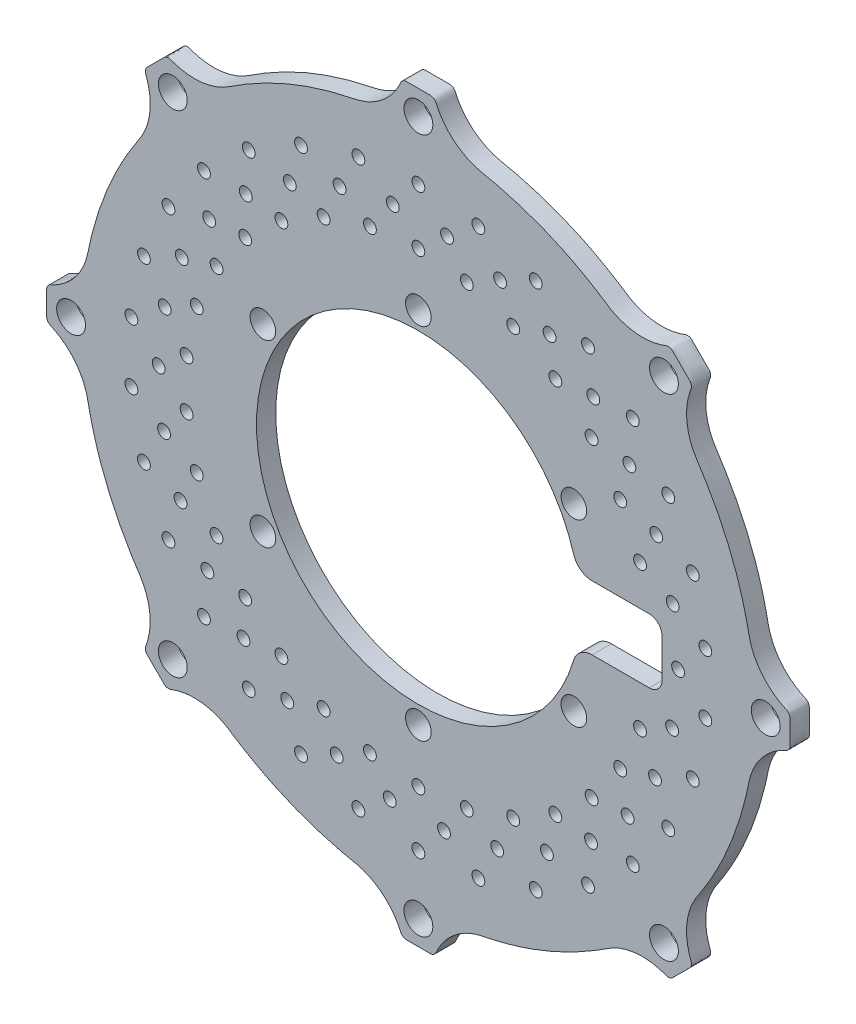
from build123d import *

# Parameters (mm, degrees)
SKETCH1_R                 = 1
BOSS_EXTRUDE1_DEPTH       = 3
F_4_0MM_DOWEL_HOLE1_D     = 4
F_4_0MM_DOWEL_HOLE1_DEPTH = 4
F_4_0MM_DOWEL_HOLE1_TIP   = 1.201721238
M4_CLEARANCE_HOLE1_D      = 4.5
M4_CLEARANCE_HOLE1_DEPTH  = 4
M4_CLEARANCE_HOLE1_TIP    = 1.351936393


with BuildPart() as part:
    # Sketch1 → Boss-Extrude1 (new body)
    with BuildSketch(Plane.XY):
        with BuildLine():
            add(Edge.make_bspline(
                [(-2.792588463, 57.296622314), (-2.798610234, 57.282848917), (-2.831786589, 57.2065726), (-2.866328079, 57.131672052), (-2.895249818, 57.070593275)],
                knots=[0.999327537, 0.999327537, 0.999327537, 0.999327537, 0.999448998, 1, 1, 1, 1], degree=3, weights=[1, 1, 1, 1, 1]))
            add(Edge.make_bspline(
                [(-2.895249818, 57.070593275), (-3.907352197, 54.933170755), (-5.586945631, 53.268270712), (-7.733178428, 52.274987752), (-8.218210626, 52.050513399), (-9.224266632, 51.679333443), (-10.81473369, 51.382377685), (-11.857368808, 51.146245707), (-12.376762361, 51.020248465), (-17.660128133, 49.738581586), (-22.682891966, 47.658084686), (-27.325071073, 44.828456262), (-27.781431281, 44.550283063), (-28.685656165, 43.979999224), (-30.020265638, 43.065348612), (-30.994118526, 42.616423452), (-31.495815419, 42.432181232), (-33.809504892, 41.582506281), (-36.274163076, 41.606308243), (-38.571011409, 42.500508575), (-38.571845248, 42.500833202), (-38.573512838, 42.50148268), (-38.57601405, 42.502457345), (-38.577681205, 42.503107942), (-38.578514782, 42.50343324), (-38.579346338, 42.50375775), (-38.581009449, 42.504406769), (-38.583504116, 42.505380297), (-38.585167228, 42.506029317), (-38.585998784, 42.506353826), (-38.590988118, 42.508300883), (-38.595977452, 42.510247941), (-38.600966787, 42.512194998), (-38.601798343, 42.512519508), (-38.603461454, 42.513168527), (-38.605956121, 42.514142055), (-38.607619233, 42.514791074), (-38.608450788, 42.515115584), (-38.60928525, 42.515441228), (-38.610954174, 42.516092515), (-38.613462374, 42.517057113), (-38.615135637, 42.517697174), (-38.615972697, 42.51801608), (-38.892469699, 42.623356827), (-39.187709119, 42.603838871), (-39.447932521, 42.463016124), (-39.476110803, 42.447767138), (-39.531001645, 42.414560688), (-39.611133429, 42.358611372), (-39.656444513, 42.313300288), (-39.679100055, 42.290644746), (-39.701755597, 42.267989204), (-39.747066681, 42.22267812), (-39.815033308, 42.154711493), (-39.860344392, 42.109400409), (-39.882999934, 42.086744867), (-40.617581578, 41.352163223), (-41.352163223, 40.617581578), (-42.086744867, 39.882999934), (-42.109400409, 39.860344392), (-42.154711493, 39.815033308), (-42.22267812, 39.747066681), (-42.267989204, 39.701755597), (-42.290644746, 39.679100055), (-42.313300288, 39.656444513), (-42.358611372, 39.611133429), (-42.414560688, 39.531001645), (-42.447767138, 39.476110803), (-42.463016124, 39.447932521), (-42.603838871, 39.187709119), (-42.623356827, 38.892469699), (-42.51801608, 38.615972697), (-42.517697174, 38.615135637), (-42.517057113, 38.613462374), (-42.516092515, 38.610954174), (-42.515441228, 38.60928525), (-42.515115584, 38.608450788), (-42.514791074, 38.607619233), (-42.514142055, 38.605956121), (-42.513168527, 38.603461454), (-42.512519508, 38.601798343), (-42.512194998, 38.600966787), (-42.510247941, 38.595977452), (-42.508300883, 38.590988118), (-42.506353826, 38.585998784), (-42.506029317, 38.585167228), (-42.505380297, 38.583504116), (-42.504406769, 38.581009449), (-42.50375775, 38.579346338), (-42.50343324, 38.578514782), (-42.503107942, 38.577681205), (-42.502457345, 38.57601405), (-42.50148268, 38.573512838), (-42.500833202, 38.571845248), (-42.500508575, 38.571011409), (-41.606308243, 36.274163076), (-41.582506281, 33.809504892), (-42.432181232, 31.495815419), (-42.616423452, 30.994118526), (-43.065348612, 30.020265638), (-43.979999224, 28.685656165), (-44.550283063, 27.781431281), (-44.828456262, 27.325071073), (-47.658084686, 22.682891966), (-49.738581586, 17.660128133), (-51.020248465, 12.376762361), (-51.146245707, 11.857368808), (-51.382377685, 10.81473369), (-51.679333443, 9.224266632), (-52.050513399, 8.218210626), (-52.274987752, 7.733178428), (-53.310202347, 5.496341992), (-55.069809391, 3.770396005), (-57.326221542, 2.778574093), (-57.327040701, 2.778214026), (-57.328679116, 2.777494111), (-57.331136932, 2.776414679), (-57.332775829, 2.775695865), (-57.333595278, 2.775336457), (-57.33441274, 2.774977922), (-57.336047663, 2.77426085), (-57.338500048, 2.773185243), (-57.340134971, 2.772468171), (-57.340952433, 2.772109635), (-57.345857202, 2.76995842), (-57.350761972, 2.767807206), (-57.355666742, 2.765655991), (-57.356484203, 2.765297455), (-57.358119126, 2.764580384), (-57.360571511, 2.763504776), (-57.362206434, 2.762787705), (-57.363023896, 2.762429169), (-57.363844214, 2.76206938), (-57.365484851, 2.761349803), (-57.367940491, 2.760258311), (-57.369576258, 2.759527727), (-57.370393649, 2.759161337), (-57.640393711, 2.638135588), (-57.835358227, 2.415568513), (-57.91978724, 2.131986062), (-57.928929633, 2.101278346), (-57.944262814, 2.038984153), (-57.961362401, 1.942760285), (-57.961362401, 1.878680735), (-57.961362401, 1.84664096), (-57.961362401, 1.814601185), (-57.961362401, 1.750521635), (-57.961362401, 1.654402311), (-57.961362401, 1.590322761), (-57.961362401, 1.558282986), (-57.961362401, 0.519427662), (-57.961362401, -0.519427662), (-57.961362401, -1.558282986), (-57.961362401, -1.590322761), (-57.961362401, -1.654402311), (-57.961362401, -1.750521635), (-57.961362401, -1.814601185), (-57.961362401, -1.84664096), (-57.961362401, -1.878680735), (-57.961362401, -1.942760285), (-57.944262814, -2.038984153), (-57.928929633, -2.101278346), (-57.91978724, -2.131986062), (-57.835358227, -2.415568513), (-57.640393711, -2.638135588), (-57.370393649, -2.759161337), (-57.369576258, -2.759527727), (-57.367940491, -2.760258311), (-57.365484851, -2.761349803), (-57.363844214, -2.76206938), (-57.363023896, -2.762429169), (-57.362206434, -2.762787705), (-57.360571511, -2.763504776), (-57.358119126, -2.764580384), (-57.356484203, -2.765297455), (-57.355666742, -2.765655991), (-57.350761972, -2.767807206), (-57.345857202, -2.76995842), (-57.340952433, -2.772109635), (-57.340134971, -2.772468171), (-57.338500048, -2.773185243), (-57.336047663, -2.77426085), (-57.33441274, -2.774977922), (-57.333595278, -2.775336457), (-57.332775829, -2.775695865), (-57.331136932, -2.776414679), (-57.328679116, -2.777494111), (-57.327040701, -2.778214026), (-57.326221542, -2.778574093), (-55.069809391, -3.770396005), (-53.310202347, -5.496341992), (-52.274987752, -7.733178428), (-52.050513399, -8.218210626), (-51.679333443, -9.224266632), (-51.382377685, -10.81473369), (-51.146245707, -11.857368808), (-51.020248465, -12.376762361), (-49.738581586, -17.660128133), (-47.658084686, -22.682891966), (-44.828456262, -27.325071073), (-44.550283063, -27.781431281), (-43.979999224, -28.685656165), (-43.065348612, -30.020265638), (-42.616423452, -30.994118526), (-42.432181232, -31.495815419), (-41.582506281, -33.809504892), (-41.606308243, -36.274163076), (-42.500508575, -38.571011409), (-42.500833202, -38.571845248), (-42.50148268, -38.573512838), (-42.502457345, -38.57601405), (-42.503107942, -38.577681205), (-42.50343324, -38.578514782), (-42.50375775, -38.579346338), (-42.504406769, -38.581009449), (-42.505380297, -38.583504116), (-42.506029317, -38.585167228), (-42.506353826, -38.585998784), (-42.508300883, -38.590988118), (-42.510247941, -38.595977452), (-42.512194998, -38.600966787), (-42.512519508, -38.601798343), (-42.513168527, -38.603461454), (-42.514142055, -38.605956121), (-42.514791074, -38.607619233), (-42.515115584, -38.608450788), (-42.515441228, -38.60928525), (-42.516092515, -38.610954174), (-42.517057113, -38.613462374), (-42.517697174, -38.615135637), (-42.51801608, -38.615972697), (-42.623356827, -38.892469699), (-42.603838871, -39.187709119), (-42.463016124, -39.447932521), (-42.447767138, -39.476110803), (-42.414560688, -39.531001645), (-42.358611372, -39.611133429), (-42.313300288, -39.656444513), (-42.290644746, -39.679100055), (-42.267989204, -39.701755597), (-42.22267812, -39.747066681), (-42.154711493, -39.815033308), (-42.109400409, -39.860344392), (-42.086744867, -39.882999934), (-41.352163223, -40.617581578), (-40.617581578, -41.352163223), (-39.882999934, -42.086744867), (-39.860344392, -42.109400409), (-39.815033308, -42.154711493), (-39.747066681, -42.22267812), (-39.701755597, -42.267989204), (-39.679100055, -42.290644746), (-39.656444513, -42.313300288), (-39.611133429, -42.358611372), (-39.531001645, -42.414560688), (-39.476110803, -42.447767138), (-39.447932521, -42.463016124), (-39.187709119, -42.603838871), (-38.892469699, -42.623356827), (-38.615972697, -42.51801608), (-38.615135637, -42.517697174), (-38.613462374, -42.517057113), (-38.610954174, -42.516092515), (-38.60928525, -42.515441228), (-38.608450788, -42.515115584), (-38.607619233, -42.514791074), (-38.605956121, -42.514142055), (-38.603461454, -42.513168527), (-38.601798343, -42.512519508), (-38.600966787, -42.512194998), (-38.595977452, -42.510247941), (-38.590988118, -42.508300883), (-38.585998784, -42.506353826), (-38.585167228, -42.506029317), (-38.583504116, -42.505380297), (-38.581009449, -42.504406769), (-38.579346338, -42.50375775), (-38.578514782, -42.50343324), (-38.577681205, -42.503107942), (-38.57601405, -42.502457345), (-38.573512838, -42.50148268), (-38.571845248, -42.500833202), (-38.571011409, -42.500508575), (-36.274163076, -41.606308243), (-33.809504892, -41.582506281), (-31.495815419, -42.432181232), (-30.994118526, -42.616423452), (-30.020265638, -43.065348612), (-28.685656165, -43.979999224), (-27.781431281, -44.550283063), (-27.325071073, -44.828456262), (-22.682891966, -47.658084686), (-17.660128133, -49.738581586), (-12.376762361, -51.020248465), (-11.857368808, -51.146245707), (-10.81473369, -51.382377685), (-9.224266632, -51.679333443), (-8.218210626, -52.050513399), (-7.733178428, -52.274987752), (-5.496341992, -53.310202347), (-3.770396005, -55.069809391), (-2.778574093, -57.326221542), (-2.778214026, -57.327040701), (-2.777494111, -57.328679116), (-2.776414679, -57.331136932), (-2.775695865, -57.332775829), (-2.775336457, -57.333595278), (-2.774977922, -57.33441274), (-2.77426085, -57.336047663), (-2.773185243, -57.338500048), (-2.772468171, -57.340134971), (-2.772109635, -57.340952433), (-2.76995842, -57.345857202), (-2.767807206, -57.350761972), (-2.765655991, -57.355666742), (-2.765297455, -57.356484203), (-2.764580384, -57.358119126), (-2.763504776, -57.360571511), (-2.762787705, -57.362206434), (-2.762429169, -57.363023896), (-2.76206938, -57.363844214), (-2.761349803, -57.365484851), (-2.760258311, -57.367940491), (-2.759527727, -57.369576258), (-2.759161337, -57.370393649), (-2.638135588, -57.640393711), (-2.415568513, -57.835358227), (-2.131986062, -57.91978724), (-2.101278346, -57.928929633), (-2.038984153, -57.944262814), (-1.942760285, -57.961362401), (-1.878680735, -57.961362401), (-1.84664096, -57.961362401), (-1.814601185, -57.961362401), (-1.750521635, -57.961362401), (-1.654402311, -57.961362401), (-1.590322761, -57.961362401), (-1.558282986, -57.961362401), (-0.519427662, -57.961362401), (0.519427662, -57.961362401), (1.558282986, -57.961362401), (1.590322761, -57.961362401), (1.654402311, -57.961362401), (1.750521635, -57.961362401), (1.814601185, -57.961362401), (1.84664096, -57.961362401), (1.878680735, -57.961362401), (1.942760285, -57.961362401), (2.038984153, -57.944262814), (2.101278346, -57.928929633), (2.131986062, -57.91978724), (2.415568513, -57.835358227), (2.638135588, -57.640393711), (2.759161337, -57.370393649), (2.759527727, -57.369576258), (2.760258311, -57.367940491), (2.761349803, -57.365484851), (2.76206938, -57.363844214), (2.762429169, -57.363023896), (2.762787705, -57.362206434), (2.763504776, -57.360571511), (2.764580384, -57.358119126), (2.765297455, -57.356484203), (2.765655991, -57.355666742), (2.767807206, -57.350761972), (2.76995842, -57.345857202), (2.772109635, -57.340952433), (2.772468171, -57.340134971), (2.773185243, -57.338500048), (2.77426085, -57.336047663), (2.774977922, -57.33441274), (2.775336457, -57.333595278), (2.775695865, -57.332775829), (2.776414679, -57.331136932), (2.777494111, -57.328679116), (2.778214026, -57.327040701), (2.778574093, -57.326221542), (3.770396005, -55.069809391), (5.496341992, -53.310202347), (7.733178428, -52.274987752), (8.218210626, -52.050513399), (9.224266632, -51.679333443), (10.81473369, -51.382377685), (11.857368808, -51.146245707), (12.376762361, -51.020248465), (17.660128133, -49.738581586), (22.682891966, -47.658084686), (27.325071073, -44.828456262), (27.781431281, -44.550283063), (28.685656165, -43.979999224), (30.020265638, -43.065348612), (30.994118526, -42.616423452), (31.495815419, -42.432181232), (33.809504892, -41.582506281), (36.274163076, -41.606308243), (38.571011409, -42.500508575), (38.571845248, -42.500833202), (38.573512838, -42.50148268), (38.57601405, -42.502457345), (38.577681205, -42.503107942), (38.578514782, -42.50343324), (38.579346338, -42.50375775), (38.581009449, -42.504406769), (38.583504116, -42.505380297), (38.585167228, -42.506029317), (38.585998784, -42.506353826), (38.590988118, -42.508300883), (38.595977452, -42.510247941), (38.600966787, -42.512194998), (38.601798343, -42.512519508), (38.603461454, -42.513168527), (38.605956121, -42.514142055), (38.607619233, -42.514791074), (38.608450788, -42.515115584), (38.60928525, -42.515441228), (38.610954174, -42.516092515), (38.613462374, -42.517057113), (38.615135637, -42.517697174), (38.615972697, -42.51801608), (38.892469699, -42.623356827), (39.187709119, -42.603838871), (39.447932521, -42.463016124), (39.476110803, -42.447767138), (39.531001645, -42.414560688), (39.611133429, -42.358611372), (39.656444513, -42.313300288), (39.679100055, -42.290644746), (39.701755597, -42.267989204), (39.747066681, -42.22267812), (39.815033308, -42.154711493), (39.860344392, -42.109400409), (39.882999934, -42.086744867), (40.617581578, -41.352163223), (41.352163223, -40.617581578), (42.086744867, -39.882999934), (42.109400409, -39.860344392), (42.154711493, -39.815033308), (42.22267812, -39.747066681), (42.267989204, -39.701755597), (42.290644746, -39.679100055), (42.313300288, -39.656444513), (42.358611372, -39.611133429), (42.414560688, -39.531001645), (42.447767138, -39.476110803), (42.463016124, -39.447932521), (42.603838871, -39.187709119), (42.623356827, -38.892469699), (42.51801608, -38.615972697), (42.517697174, -38.615135637), (42.517057113, -38.613462374), (42.516092515, -38.610954174), (42.515441228, -38.60928525), (42.515115584, -38.608450788), (42.514791074, -38.607619233), (42.514142055, -38.605956121), (42.513168527, -38.603461454), (42.512519508, -38.601798343), (42.512194998, -38.600966787), (42.510247941, -38.595977452), (42.508300883, -38.590988118), (42.506353826, -38.585998784), (42.506029317, -38.585167228), (42.505380297, -38.583504116), (42.504406769, -38.581009449), (42.50375775, -38.579346338), (42.50343324, -38.578514782), (42.503107942, -38.577681205), (42.502457345, -38.57601405), (42.50148268, -38.573512838), (42.500833202, -38.571845248), (42.500508575, -38.571011409), (41.606308243, -36.274163076), (41.582506281, -33.809504892), (42.432181232, -31.495815419), (42.616423452, -30.994118526), (43.065348612, -30.020265638), (43.979999224, -28.685656165), (44.550283063, -27.781431281), (44.828456262, -27.325071073), (47.658084686, -22.682891966), (49.738581586, -17.660128133), (51.020248465, -12.376762361), (51.146245707, -11.857368808), (51.382377685, -10.81473369), (51.679333443, -9.224266632), (52.050513399, -8.218210626), (52.274987752, -7.733178428), (53.310202347, -5.496341992), (55.069809391, -3.770396005), (57.326221542, -2.778574093), (57.327040701, -2.778214026), (57.328679116, -2.777494111), (57.331136932, -2.776414679), (57.332775829, -2.775695865), (57.333595278, -2.775336457), (57.33441274, -2.774977922), (57.336047663, -2.77426085), (57.338500048, -2.773185243), (57.340134971, -2.772468171), (57.340952433, -2.772109635), (57.345857202, -2.76995842), (57.350761972, -2.767807206), (57.355666742, -2.765655991), (57.356484203, -2.765297455), (57.358119126, -2.764580384), (57.360571511, -2.763504776), (57.362206434, -2.762787705), (57.363023896, -2.762429169), (57.363844214, -2.76206938), (57.365484851, -2.761349803), (57.367940491, -2.760258311), (57.369576258, -2.759527727), (57.370393649, -2.759161337), (57.640393711, -2.638135588), (57.835358227, -2.415568513), (57.91978724, -2.131986062), (57.928929633, -2.101278346), (57.944262814, -2.038984153), (57.961362401, -1.942760285), (57.961362401, -1.878680735), (57.961362401, -1.84664096), (57.961362401, -1.814601185), (57.961362401, -1.750521635), (57.961362401, -1.654402311), (57.961362401, -1.590322761), (57.961362401, -1.558282986), (57.961362401, -0.519427662), (57.961362401, 0.519427662), (57.961362401, 1.558282986), (57.961362401, 1.590322761), (57.961362401, 1.654402311), (57.961362401, 1.750521635), (57.961362401, 1.814601185), (57.961362401, 1.84664096), (57.961362401, 1.878680735), (57.961362401, 1.942760285), (57.944262814, 2.038984153), (57.928929633, 2.101278346), (57.91978724, 2.131986062), (57.835358227, 2.415568513), (57.640393711, 2.638135588), (57.370393649, 2.759161337), (57.369576258, 2.759527727), (57.367940491, 2.760258311), (57.365484851, 2.761349803), (57.363844214, 2.76206938), (57.363023896, 2.762429169), (57.362206434, 2.762787705), (57.360571511, 2.763504776), (57.358119126, 2.764580384), (57.356484203, 2.765297455), (57.355666742, 2.765655991), (57.350761972, 2.767807206), (57.345857202, 2.76995842), (57.340952433, 2.772109635), (57.340134971, 2.772468171), (57.338500048, 2.773185243), (57.336047663, 2.77426085), (57.33441274, 2.774977922), (57.333595278, 2.775336457), (57.332775829, 2.775695865), (57.331136932, 2.776414679), (57.328679116, 2.777494111), (57.327040701, 2.778214026), (57.326221542, 2.778574093), (55.069809391, 3.770396005), (53.310202347, 5.496341992), (52.274987752, 7.733178428), (52.050513399, 8.218210626), (51.679333443, 9.224266632), (51.382377685, 10.81473369), (51.146245707, 11.857368808), (51.020248465, 12.376762361), (49.738581586, 17.660128133), (47.658084686, 22.682891966), (44.828456262, 27.325071073), (44.550283063, 27.781431281), (43.979999224, 28.685656165), (43.065348612, 30.020265638), (42.616423452, 30.994118526), (42.432181232, 31.495815419), (41.582506281, 33.809504892), (41.606308243, 36.274163076), (42.500508575, 38.571011409), (42.500833202, 38.571845248), (42.50148268, 38.573512838), (42.502457345, 38.57601405), (42.503107942, 38.577681205), (42.50343324, 38.578514782), (42.50375775, 38.579346338), (42.504406769, 38.581009449), (42.505380297, 38.583504116), (42.506029317, 38.585167228), (42.506353826, 38.585998784), (42.508300883, 38.590988118), (42.510247941, 38.595977452), (42.512194998, 38.600966787), (42.512519508, 38.601798343), (42.513168527, 38.603461454), (42.514142055, 38.605956121), (42.514791074, 38.607619233), (42.515115584, 38.608450788), (42.515441228, 38.60928525), (42.516092515, 38.610954174), (42.517057113, 38.613462374), (42.517697174, 38.615135637), (42.51801608, 38.615972697), (42.623356827, 38.892469699), (42.603838871, 39.187709119), (42.463016124, 39.447932521), (42.447767138, 39.476110803), (42.414560688, 39.531001645), (42.358611372, 39.611133429), (42.313300288, 39.656444513), (42.290644746, 39.679100055), (42.267989204, 39.701755597), (42.22267812, 39.747066681), (42.154711493, 39.815033308), (42.109400409, 39.860344392), (42.086744867, 39.882999934), (41.352163223, 40.617581578), (40.617581578, 41.352163223), (39.882999934, 42.086744867), (39.860344392, 42.109400409), (39.815033308, 42.154711493), (39.747066681, 42.22267812), (39.701755597, 42.267989204), (39.679100055, 42.290644746), (39.656444513, 42.313300288), (39.611133429, 42.358611372), (39.531001645, 42.414560688), (39.476110803, 42.447767138), (39.447932521, 42.463016124), (39.187709119, 42.603838871), (38.892469699, 42.623356827), (38.615972697, 42.51801608), (38.615135637, 42.517697174), (38.613462374, 42.517057113), (38.610954174, 42.516092515), (38.60928525, 42.515441228), (38.608450788, 42.515115584), (38.607619233, 42.514791074), (38.605956121, 42.514142055), (38.603461454, 42.513168527), (38.601798343, 42.512519508), (38.600966787, 42.512194998), (38.595977452, 42.510247941), (38.590988118, 42.508300883), (38.585998784, 42.506353826), (38.585167228, 42.506029317), (38.583504116, 42.505380297), (38.581009449, 42.504406769), (38.579346338, 42.50375775), (38.578514782, 42.50343324), (38.577681205, 42.503107942), (38.57601405, 42.502457345), (38.573512838, 42.50148268), (38.571845248, 42.500833202), (38.571011409, 42.500508575), (36.274163076, 41.606308243), (33.809504892, 41.582506281), (31.495815419, 42.432181232), (30.994118526, 42.616423452), (30.020265638, 43.065348612), (28.685656165, 43.979999224), (27.781431281, 44.550283063), (27.325071073, 44.828456262), (22.682891966, 47.658084686), (17.660128133, 49.738581586), (12.376762361, 51.020248465), (11.857368808, 51.146245707), (10.81473369, 51.382377685), (9.224266632, 51.679333443), (8.218210626, 52.050513399), (7.733178428, 52.274987752), (5.586945631, 53.268270712), (3.907352197, 54.933170755), (2.895249818, 57.070593275), (2.866328079, 57.131672052), (2.809722916, 57.254415967), (2.730314338, 57.444073844), (2.653418588, 57.556069844), (2.609742987, 57.607640434), (2.483296792, 57.756943586), (2.319504695, 57.863958634), (2.131986062, 57.91978724), (2.101278346, 57.928929633), (2.038984153, 57.944262814), (1.942760285, 57.961362401), (1.878680735, 57.961362401), (1.84664096, 57.961362401), (1.814601185, 57.961362401), (1.750521635, 57.961362401), (1.654402311, 57.961362401), (1.590322761, 57.961362401), (1.558282986, 57.961362401), (0.519427662, 57.961362401), (-0.519427662, 57.961362401), (-1.558282986, 57.961362401), (-1.590322761, 57.961362401), (-1.654402311, 57.961362401), (-1.750521635, 57.961362401), (-1.814601185, 57.961362401), (-1.84664096, 57.961362401), (-1.878680735, 57.961362401), (-1.942760285, 57.961362401), (-2.038984153, 57.944262814), (-2.101278346, 57.928929633), (-2.131986062, 57.91978724), (-2.319504695, 57.863958634), (-2.483296792, 57.756943586), (-2.609742987, 57.607640434), (-2.653418588, 57.556069844), (-2.721839041, 57.456417821), (-2.77129269, 57.34533143), (-2.792588463, 57.296622314)],
                knots=[0, 0, 0, 0, 0.018513449, 0.018513449, 0.018513449, 0.022871046, 0.027228642, 0.031586239, 0.031586239, 0.031586239, 0.075559554, 0.075559554, 0.075559554, 0.079917151, 0.084274748, 0.088632345, 0.088632345, 0.088632345, 0.107861988, 0.107861988, 0.107861988, 0.107869283, 0.107876579, 0.107883874, 0.107883874, 0.107883874, 0.107891152, 0.10789843, 0.107905708, 0.107905708, 0.107905708, 0.107949375, 0.107949375, 0.107949375, 0.107956653, 0.107963931, 0.107971209, 0.107971209, 0.107971209, 0.107978512, 0.107985816, 0.107993119, 0.107993119, 0.107993119, 0.110259129, 0.110259129, 0.110259129, 0.110520359, 0.110781589, 0.111042819, 0.111042819, 0.111042819, 0.111304049, 0.11156528, 0.11182651, 0.11182651, 0.11182651, 0.120296615, 0.120296615, 0.120296615, 0.120557845, 0.120819075, 0.121080305, 0.121080305, 0.121080305, 0.121341536, 0.121602766, 0.121863996, 0.121863996, 0.121863996, 0.124130006, 0.124130006, 0.124130006, 0.124137309, 0.124144612, 0.124151916, 0.124151916, 0.124151916, 0.124159193, 0.124166471, 0.124173749, 0.124173749, 0.124173749, 0.124217417, 0.124217417, 0.124217417, 0.124224695, 0.124231972, 0.12423925, 0.12423925, 0.12423925, 0.124246546, 0.124253842, 0.124261137, 0.124261137, 0.124261137, 0.14349078, 0.14349078, 0.14349078, 0.147848377, 0.152205974, 0.15656357, 0.15656357, 0.15656357, 0.200536886, 0.200536886, 0.200536886, 0.204894482, 0.209252079, 0.213609676, 0.213609676, 0.213609676, 0.232839319, 0.232839319, 0.232839319, 0.232846615, 0.23285391, 0.232861206, 0.232861206, 0.232861206, 0.232868484, 0.232875762, 0.232883039, 0.232883039, 0.232883039, 0.232926707, 0.232926707, 0.232926707, 0.232933985, 0.232941263, 0.232948541, 0.232948541, 0.232948541, 0.232955844, 0.232963147, 0.232970451, 0.232970451, 0.232970451, 0.23523646, 0.23523646, 0.23523646, 0.23549769, 0.235758921, 0.236020151, 0.236020151, 0.236020151, 0.236281381, 0.236542611, 0.236803841, 0.236803841, 0.236803841, 0.245273946, 0.245273946, 0.245273946, 0.245535177, 0.245796407, 0.246057637, 0.246057637, 0.246057637, 0.246318867, 0.246580097, 0.246841327, 0.246841327, 0.246841327, 0.249107337, 0.249107337, 0.249107337, 0.24911464, 0.249121944, 0.249129247, 0.249129247, 0.249129247, 0.249136525, 0.249143803, 0.249151081, 0.249151081, 0.249151081, 0.249194748, 0.249194748, 0.249194748, 0.249202026, 0.249209304, 0.249216582, 0.249216582, 0.249216582, 0.249223877, 0.249231173, 0.249238469, 0.249238469, 0.249238469, 0.268468112, 0.268468112, 0.268468112, 0.272825708, 0.277183305, 0.281540902, 0.281540902, 0.281540902, 0.325514217, 0.325514217, 0.325514217, 0.329871814, 0.334229411, 0.338587007, 0.338587007, 0.338587007, 0.35781665, 0.35781665, 0.35781665, 0.357823946, 0.357831241, 0.357838537, 0.357838537, 0.357838537, 0.357845815, 0.357853093, 0.357860371, 0.357860371, 0.357860371, 0.357904038, 0.357904038, 0.357904038, 0.357911316, 0.357918594, 0.357925872, 0.357925872, 0.357925872, 0.357933175, 0.357940479, 0.357947782, 0.357947782, 0.357947782, 0.360213792, 0.360213792, 0.360213792, 0.360475022, 0.360736252, 0.360997482, 0.360997482, 0.360997482, 0.361258712, 0.361519942, 0.361781172, 0.361781172, 0.361781172, 0.370251278, 0.370251278, 0.370251278, 0.370512508, 0.370773738, 0.371034968, 0.371034968, 0.371034968, 0.371296198, 0.371557428, 0.371818658, 0.371818658, 0.371818658, 0.374084668, 0.374084668, 0.374084668, 0.374091972, 0.374099275, 0.374106578, 0.374106578, 0.374106578, 0.374113856, 0.374121134, 0.374128412, 0.374128412, 0.374128412, 0.374172079, 0.374172079, 0.374172079, 0.374179357, 0.374186635, 0.374193913, 0.374193913, 0.374193913, 0.374201209, 0.374208504, 0.3742158, 0.3742158, 0.3742158, 0.393445443, 0.393445443, 0.393445443, 0.39780304, 0.402160636, 0.406518233, 0.406518233, 0.406518233, 0.450491548, 0.450491548, 0.450491548, 0.454849145, 0.459206742, 0.463564339, 0.463564339, 0.463564339, 0.482793982, 0.482793982, 0.482793982, 0.482801277, 0.482808573, 0.482815868, 0.482815868, 0.482815868, 0.482823146, 0.482830424, 0.482837702, 0.482837702, 0.482837702, 0.48288137, 0.48288137, 0.48288137, 0.482888647, 0.482895925, 0.482903203, 0.482903203, 0.482903203, 0.482910507, 0.48291781, 0.482925113, 0.482925113, 0.482925113, 0.485191123, 0.485191123, 0.485191123, 0.485452353, 0.485713583, 0.485974813, 0.485974813, 0.485974813, 0.486236043, 0.486497274, 0.486758504, 0.486758504, 0.486758504, 0.495228609, 0.495228609, 0.495228609, 0.495489839, 0.495751069, 0.496012299, 0.496012299, 0.496012299, 0.49627353, 0.49653476, 0.49679599, 0.49679599, 0.49679599, 0.499062, 0.499062, 0.499062, 0.499069303, 0.499076606, 0.49908391, 0.49908391, 0.49908391, 0.499091188, 0.499098465, 0.499105743, 0.499105743, 0.499105743, 0.499149411, 0.499149411, 0.499149411, 0.499156689, 0.499163967, 0.499171244, 0.499171244, 0.499171244, 0.49917854, 0.499185836, 0.499193131, 0.499193131, 0.499193131, 0.518422774, 0.518422774, 0.518422774, 0.522780371, 0.527137968, 0.531495564, 0.531495564, 0.531495564, 0.57546888, 0.57546888, 0.57546888, 0.579826476, 0.584184073, 0.58854167, 0.58854167, 0.58854167, 0.607771313, 0.607771313, 0.607771313, 0.607778609, 0.607785904, 0.6077932, 0.6077932, 0.6077932, 0.607800478, 0.607807756, 0.607815033, 0.607815033, 0.607815033, 0.607858701, 0.607858701, 0.607858701, 0.607865979, 0.607873257, 0.607880535, 0.607880535, 0.607880535, 0.607887838, 0.607895141, 0.607902445, 0.607902445, 0.607902445, 0.610168454, 0.610168454, 0.610168454, 0.610429685, 0.610690915, 0.610952145, 0.610952145, 0.610952145, 0.611213375, 0.611474605, 0.611735835, 0.611735835, 0.611735835, 0.620205941, 0.620205941, 0.620205941, 0.620467171, 0.620728401, 0.620989631, 0.620989631, 0.620989631, 0.621250861, 0.621512091, 0.621773321, 0.621773321, 0.621773321, 0.624039331, 0.624039331, 0.624039331, 0.624046634, 0.624053938, 0.624061241, 0.624061241, 0.624061241, 0.624068519, 0.624075797, 0.624083075, 0.624083075, 0.624083075, 0.624126742, 0.624126742, 0.624126742, 0.62413402, 0.624141298, 0.624148576, 0.624148576, 0.624148576, 0.624155871, 0.624163167, 0.624170463, 0.624170463, 0.624170463, 0.643400106, 0.643400106, 0.643400106, 0.647757702, 0.652115299, 0.656472896, 0.656472896, 0.656472896, 0.700446211, 0.700446211, 0.700446211, 0.704803808, 0.709161405, 0.713519001, 0.713519001, 0.713519001, 0.732748644, 0.732748644, 0.732748644, 0.73275594, 0.732763235, 0.732770531, 0.732770531, 0.732770531, 0.732777809, 0.732785087, 0.732792365, 0.732792365, 0.732792365, 0.732836032, 0.732836032, 0.732836032, 0.73284331, 0.732850588, 0.732857866, 0.732857866, 0.732857866, 0.732865169, 0.732872473, 0.732879776, 0.732879776, 0.732879776, 0.735145786, 0.735145786, 0.735145786, 0.735407016, 0.735668246, 0.735929476, 0.735929476, 0.735929476, 0.736190706, 0.736451936, 0.736713166, 0.736713166, 0.736713166, 0.745183272, 0.745183272, 0.745183272, 0.745444502, 0.745705732, 0.745966962, 0.745966962, 0.745966962, 0.746228192, 0.746489422, 0.746750652, 0.746750652, 0.746750652, 0.749016662, 0.749016662, 0.749016662, 0.749023966, 0.749031269, 0.749038572, 0.749038572, 0.749038572, 0.74904585, 0.749053128, 0.749060406, 0.749060406, 0.749060406, 0.749104073, 0.749104073, 0.749104073, 0.749111351, 0.749118629, 0.749125907, 0.749125907, 0.749125907, 0.749133203, 0.749140498, 0.749147794, 0.749147794, 0.749147794, 0.768377437, 0.768377437, 0.768377437, 0.772735034, 0.77709263, 0.781450227, 0.781450227, 0.781450227, 0.825423542, 0.825423542, 0.825423542, 0.829781139, 0.834138736, 0.838496333, 0.838496333, 0.838496333, 0.857725976, 0.857725976, 0.857725976, 0.857733271, 0.857740567, 0.857747862, 0.857747862, 0.857747862, 0.85775514, 0.857762418, 0.857769696, 0.857769696, 0.857769696, 0.857813364, 0.857813364, 0.857813364, 0.857820641, 0.857827919, 0.857835197, 0.857835197, 0.857835197, 0.857842501, 0.857849804, 0.857857107, 0.857857107, 0.857857107, 0.860123117, 0.860123117, 0.860123117, 0.860384347, 0.860645577, 0.860906807, 0.860906807, 0.860906807, 0.861168037, 0.861429268, 0.861690498, 0.861690498, 0.861690498, 0.870160603, 0.870160603, 0.870160603, 0.870421833, 0.870683063, 0.870944293, 0.870944293, 0.870944293, 0.871205524, 0.871466754, 0.871727984, 0.871727984, 0.871727984, 0.873993994, 0.873993994, 0.873993994, 0.874001297, 0.8740086, 0.874015904, 0.874015904, 0.874015904, 0.874023182, 0.874030459, 0.874037737, 0.874037737, 0.874037737, 0.874081405, 0.874081405, 0.874081405, 0.874088683, 0.874095961, 0.874103238, 0.874103238, 0.874103238, 0.874110534, 0.87411783, 0.874125125, 0.874125125, 0.874125125, 0.893354768, 0.893354768, 0.893354768, 0.897712365, 0.902069962, 0.906427559, 0.906427559, 0.906427559, 0.950400874, 0.950400874, 0.950400874, 0.95475847, 0.959116067, 0.963473664, 0.963473664, 0.963473664, 0.981987113, 0.981987113, 0.981987113, 0.982538115, 0.983089117, 0.983640119, 0.983640119, 0.983640119, 0.985191123, 0.985191123, 0.985191123, 0.985452353, 0.985713583, 0.985974813, 0.985974813, 0.985974813, 0.986236043, 0.986497274, 0.986758504, 0.986758504, 0.986758504, 0.995228609, 0.995228609, 0.995228609, 0.995489839, 0.995751069, 0.996012299, 0.996012299, 0.996012299, 0.99627353, 0.99653476, 0.99679599, 0.99679599, 0.99679599, 0.998346994, 0.998346994, 0.998346994, 0.998897996, 0.999327537, 0.999327537, 0.999327537, 0.999327537], degree=3, weights=[1, 0.960138827, 0.960138827, 1, 1, 1, 1, 1, 1, 0.992037399, 0.992037399, 1, 1, 1, 1, 1, 1, 0.956886711, 0.956886711, 1, 1, 1, 1, 1, 1, 1, 1, 1, 1, 1, 1, 1, 1, 1, 1, 1, 1, 1, 1, 1, 1, 1, 1, 0.939305267, 0.939305267, 1, 1, 1, 1, 1, 1, 1, 1, 1, 1, 1, 1, 1, 1, 1, 1, 1, 1, 1, 1, 1, 1, 1, 1, 0.939305267, 0.939305267, 1, 1, 1, 1, 1, 1, 1, 1, 1, 1, 1, 1, 1, 1, 1, 1, 1, 1, 1, 1, 1, 1, 1, 1, 0.956886711, 0.956886711, 1, 1, 1, 1, 1, 1, 0.992037399, 0.992037399, 1, 1, 1, 1, 1, 1, 0.956886711, 0.956886711, 1, 1, 1, 1, 1, 1, 1, 1, 1, 1, 1, 1, 1, 1, 1, 1, 1, 1, 1, 1, 1, 1, 1, 1, 0.939305267, 0.939305267, 1, 1, 1, 1, 1, 1, 1, 1, 1, 1, 1, 1, 1, 1, 1, 1, 1, 1, 1, 1, 1, 1, 1, 1, 0.939305267, 0.939305267, 1, 1, 1, 1, 1, 1, 1, 1, 1, 1, 1, 1, 1, 1, 1, 1, 1, 1, 1, 1, 1, 1, 1, 1, 0.956886711, 0.956886711, 1, 1, 1, 1, 1, 1, 0.992037399, 0.992037399, 1, 1, 1, 1, 1, 1, 0.956886711, 0.956886711, 1, 1, 1, 1, 1, 1, 1, 1, 1, 1, 1, 1, 1, 1, 1, 1, 1, 1, 1, 1, 1, 1, 1, 1, 0.939305267, 0.939305267, 1, 1, 1, 1, 1, 1, 1, 1, 1, 1, 1, 1, 1, 1, 1, 1, 1, 1, 1, 1, 1, 1, 1, 1, 0.939305267, 0.939305267, 1, 1, 1, 1, 1, 1, 1, 1, 1, 1, 1, 1, 1, 1, 1, 1, 1, 1, 1, 1, 1, 1, 1, 1, 0.956886711, 0.956886711, 1, 1, 1, 1, 1, 1, 0.992037399, 0.992037399, 1, 1, 1, 1, 1, 1, 0.956886711, 0.956886711, 1, 1, 1, 1, 1, 1, 1, 1, 1, 1, 1, 1, 1, 1, 1, 1, 1, 1, 1, 1, 1, 1, 1, 1, 0.939305267, 0.939305267, 1, 1, 1, 1, 1, 1, 1, 1, 1, 1, 1, 1, 1, 1, 1, 1, 1, 1, 1, 1, 1, 1, 1, 1, 0.939305267, 0.939305267, 1, 1, 1, 1, 1, 1, 1, 1, 1, 1, 1, 1, 1, 1, 1, 1, 1, 1, 1, 1, 1, 1, 1, 1, 0.956886711, 0.956886711, 1, 1, 1, 1, 1, 1, 0.992037399, 0.992037399, 1, 1, 1, 1, 1, 1, 0.956886711, 0.956886711, 1, 1, 1, 1, 1, 1, 1, 1, 1, 1, 1, 1, 1, 1, 1, 1, 1, 1, 1, 1, 1, 1, 1, 1, 0.939305267, 0.939305267, 1, 1, 1, 1, 1, 1, 1, 1, 1, 1, 1, 1, 1, 1, 1, 1, 1, 1, 1, 1, 1, 1, 1, 1, 0.939305267, 0.939305267, 1, 1, 1, 1, 1, 1, 1, 1, 1, 1, 1, 1, 1, 1, 1, 1, 1, 1, 1, 1, 1, 1, 1, 1, 0.956886711, 0.956886711, 1, 1, 1, 1, 1, 1, 0.992037399, 0.992037399, 1, 1, 1, 1, 1, 1, 0.956886711, 0.956886711, 1, 1, 1, 1, 1, 1, 1, 1, 1, 1, 1, 1, 1, 1, 1, 1, 1, 1, 1, 1, 1, 1, 1, 1, 0.939305267, 0.939305267, 1, 1, 1, 1, 1, 1, 1, 1, 1, 1, 1, 1, 1, 1, 1, 1, 1, 1, 1, 1, 1, 1, 1, 1, 0.939305267, 0.939305267, 1, 1, 1, 1, 1, 1, 1, 1, 1, 1, 1, 1, 1, 1, 1, 1, 1, 1, 1, 1, 1, 1, 1, 1, 0.956886711, 0.956886711, 1, 1, 1, 1, 1, 1, 0.992037399, 0.992037399, 1, 1, 1, 1, 1, 1, 0.956886711, 0.956886711, 1, 1, 1, 1, 1, 1, 1, 1, 1, 1, 1, 1, 1, 1, 1, 1, 1, 1, 1, 1, 1, 1, 1, 1, 0.939305267, 0.939305267, 1, 1, 1, 1, 1, 1, 1, 1, 1, 1, 1, 1, 1, 1, 1, 1, 1, 1, 1, 1, 1, 1, 1, 1, 0.939305267, 0.939305267, 1, 1, 1, 1, 1, 1, 1, 1, 1, 1, 1, 1, 1, 1, 1, 1, 1, 1, 1, 1, 1, 1, 1, 1, 0.956886711, 0.956886711, 1, 1, 1, 1, 1, 1, 0.992037399, 0.992037399, 1, 1, 1, 1, 1, 1, 0.960138827, 0.960138827, 1, 1, 1, 1, 1, 1, 0.972283226, 0.972283226, 1, 1, 1, 1, 1, 1, 1, 1, 1, 1, 1, 1, 1, 1, 1, 1, 1, 1, 1, 1, 1, 1, 1, 1, 0.972283226, 0.972283226, 1, 1, 1, 1, 1]))
        make_face()
        with Locations((-33.441517146, -30.110877286)):
            Circle(SKETCH1_R, mode=Mode.SUBTRACT)
        with Locations((-9.356026087, -44.016642033)):
            Circle(SKETCH1_R, mode=Mode.SUBTRACT)
        with Locations((-26.450336353, -36.405764747)):
            Circle(SKETCH1_R, mode=Mode.SUBTRACT)
        with Locations((-18.303148938, -41.109545594)):
            Circle(SKETCH1_R, mode=Mode.SUBTRACT)
        with Locations((-27.275735052, -29.938007238)):
            Circle(SKETCH1_R, mode=Mode.SUBTRACT)
        with Locations((-20.455233094, -34.954734144)):
            Circle(SKETCH1_R, mode=Mode.SUBTRACT)
        with Locations((-14.783072566, -33.203324615)):
            Circle(SKETCH1_R, mode=Mode.SUBTRACT)
        with Locations((-21.363386324, -29.404178696)):
            Circle(SKETCH1_R, mode=Mode.SUBTRACT)
        with Locations((-12.740739296, -38.443771436)):
            Circle(SKETCH1_R, mode=Mode.SUBTRACT)
        with Locations((-4.469414053, -40.252631442)):
            Circle(SKETCH1_R, mode=Mode.SUBTRACT)
        with Locations((-7.556667601, -35.551325921)):
            Circle(SKETCH1_R, mode=Mode.SUBTRACT)
        with Locations((-38.97114317, -22.5)):
            Circle(SKETCH1_R, mode=Mode.SUBTRACT)
        with Locations((-32.904156504, -23.612845758)):
            Circle(SKETCH1_R, mode=Mode.SUBTRACT)
        with Locations((-37.094508425, -16.255689611)):
            Circle(SKETCH1_R, mode=Mode.SUBTRACT)
        with Locations((-31.476181471, -18.172781845)):
            Circle(SKETCH1_R, mode=Mode.SUBTRACT)
        with Locations((-44.753485292, -4.703780847)):
            Circle(SKETCH1_R, mode=Mode.SUBTRACT)
        with Locations((-42.797543233, -13.905764747)):
            Circle(SKETCH1_R, mode=Mode.SUBTRACT)
        with Locations((-39.663652328, -8.188081825)):
            Circle(SKETCH1_R, mode=Mode.SUBTRACT)
        with Locations((-34.566685187, -11.231396851)):
            Circle(SKETCH1_R, mode=Mode.SUBTRACT)
        with Locations((-36.14645889, -3.799145919)):
            Circle(SKETCH1_R, mode=Mode.SUBTRACT)
        with Locations((-27.010017586, -24.319929071)):
            Circle(SKETCH1_R, mode=Mode.SUBTRACT)
        with Locations((0, -45)):
            Circle(SKETCH1_R, mode=Mode.SUBTRACT)
        with Locations((9.356026087, -44.016642033)):
            Circle(SKETCH1_R, mode=Mode.SUBTRACT)
        with Locations((3.99724603, -40.302258301)):
            Circle(SKETCH1_R, mode=Mode.SUBTRACT)
        with Locations((0, -36.345563691)):
            Circle(SKETCH1_R, mode=Mode.SUBTRACT)
        with Locations((12.289207281, -38.590483081)):
            Circle(SKETCH1_R, mode=Mode.SUBTRACT)
        with Locations((7.556667601, -35.551325921)):
            Circle(SKETCH1_R, mode=Mode.SUBTRACT)
        with Locations((18.303148938, -41.109545594)):
            Circle(SKETCH1_R, mode=Mode.SUBTRACT)
        with Locations((26.450336353, -36.405764747)):
            Circle(SKETCH1_R, mode=Mode.SUBTRACT)
        with Locations((14.783072566, -33.203324615)):
            Circle(SKETCH1_R, mode=Mode.SUBTRACT)
        with Locations((20.044071204, -35.192118572)):
            Circle(SKETCH1_R, mode=Mode.SUBTRACT)
        with Locations((21.363386324, -29.404178696)):
            Circle(SKETCH1_R, mode=Mode.SUBTRACT)
        with Locations((26.922913033, -30.255689611)):
            Circle(SKETCH1_R, mode=Mode.SUBTRACT)
        with Locations((33.441517146, -30.110877286)):
            Circle(SKETCH1_R, mode=Mode.SUBTRACT)
        with Locations((27.010017586, -24.319929071)):
            Circle(SKETCH1_R, mode=Mode.SUBTRACT)
        with Locations((32.625094372, -23.996941831)):
            Circle(SKETCH1_R, mode=Mode.SUBTRACT)
        with Locations((38.97114317, -22.5)):
            Circle(SKETCH1_R, mode=Mode.SUBTRACT)
        with Locations((31.476181471, -18.172781845)):
            Circle(SKETCH1_R, mode=Mode.SUBTRACT)
        with Locations((36.901402534, -16.689412543)):
            Circle(SKETCH1_R, mode=Mode.SUBTRACT)
        with Locations((34.566685187, -11.231396851)):
            Circle(SKETCH1_R, mode=Mode.SUBTRACT)
        with Locations((42.797543233, -13.905764747)):
            Circle(SKETCH1_R, mode=Mode.SUBTRACT)
        with Locations((39.564942333, -8.652475842)):
            Circle(SKETCH1_R, mode=Mode.SUBTRACT)
        with Locations((40.499304298, -0.237384428)):
            Circle(SKETCH1_R, mode=Mode.SUBTRACT)
        with Locations((44.753485292, -4.703780847)):
            Circle(SKETCH1_R, mode=Mode.SUBTRACT)
        with Locations((-44.753485292, 4.703780847)):
            Circle(SKETCH1_R, mode=Mode.SUBTRACT)
        with Locations((-40.499304298, 0.237384428)):
            Circle(SKETCH1_R, mode=Mode.SUBTRACT)
        with Locations((-36.14645889, 3.799145919)):
            Circle(SKETCH1_R, mode=Mode.SUBTRACT)
        with Locations((-39.564942333, 8.652475842)):
            Circle(SKETCH1_R, mode=Mode.SUBTRACT)
        with Locations((-42.797543233, 13.905764747)):
            Circle(SKETCH1_R, mode=Mode.SUBTRACT)
        with Locations((-34.566685187, 11.231396851)):
            Circle(SKETCH1_R, mode=Mode.SUBTRACT)
        with Locations((-36.901402534, 16.689412543)):
            Circle(SKETCH1_R, mode=Mode.SUBTRACT)
        with Locations((-31.476181471, 18.172781845)):
            Circle(SKETCH1_R, mode=Mode.SUBTRACT)
        with Locations((-38.97114317, 22.5)):
            Circle(SKETCH1_R, mode=Mode.SUBTRACT)
        with Locations((-32.625094372, 23.996941831)):
            Circle(SKETCH1_R, mode=Mode.SUBTRACT)
        with Locations((-27.010017586, 24.319929071)):
            Circle(SKETCH1_R, mode=Mode.SUBTRACT)
        with Locations((-33.441517146, 30.110877286)):
            Circle(SKETCH1_R, mode=Mode.SUBTRACT)
        with Locations((-26.922913033, 30.255689611)):
            Circle(SKETCH1_R, mode=Mode.SUBTRACT)
        with Locations((-21.363386324, 29.404178696)):
            Circle(SKETCH1_R, mode=Mode.SUBTRACT)
        with Locations((-20.044071204, 35.192118572)):
            Circle(SKETCH1_R, mode=Mode.SUBTRACT)
        with Locations((-14.783072566, 33.203324615)):
            Circle(SKETCH1_R, mode=Mode.SUBTRACT)
        with Locations((-26.450336353, 36.405764747)):
            Circle(SKETCH1_R, mode=Mode.SUBTRACT)
        with Locations((-18.303148938, 41.109545594)):
            Circle(SKETCH1_R, mode=Mode.SUBTRACT)
        with Locations((-7.556667601, 35.551325921)):
            Circle(SKETCH1_R, mode=Mode.SUBTRACT)
        with Locations((-12.289207281, 38.590483081)):
            Circle(SKETCH1_R, mode=Mode.SUBTRACT)
        with Locations((0, 36.345563691)):
            Circle(SKETCH1_R, mode=Mode.SUBTRACT)
        with Locations((-3.99724603, 40.302258301)):
            Circle(SKETCH1_R, mode=Mode.SUBTRACT)
        with Locations((-9.356026087, 44.016642033)):
            Circle(SKETCH1_R, mode=Mode.SUBTRACT)
        with Locations((0, 45)):
            Circle(SKETCH1_R, mode=Mode.SUBTRACT)
        with BuildLine():
            Line((38, 3), (38, -3))
            ThreePointArc((38, -3), (37.414213562, -4.414213562), (36, -5))
            Line((36, -5), (27.093587802, -5))
            ThreePointArc((27.093587802, -5), (25.297574518, -5.59701513), (24.216392637, -7.150442478))
            ThreePointArc((24.216392637, -7.150442478), (-25.25, 0), (24.216392637, 7.150442478))
            ThreePointArc((24.216392637, 7.150442478), (25.297574518, 5.59701513), (27.093587802, 5))
            Line((27.093587802, 5), (36, 5))
            ThreePointArc((36, 5), (37.414213562, 4.414213562), (38, 3))
        make_face(mode=Mode.SUBTRACT)
        with Locations((27.010017586, 24.319929071)):
            Circle(SKETCH1_R, mode=Mode.SUBTRACT)
        with Locations((34.566685187, 11.231396851)):
            Circle(SKETCH1_R, mode=Mode.SUBTRACT)
        with Locations((39.663652328, 8.188081825)):
            Circle(SKETCH1_R, mode=Mode.SUBTRACT)
        with Locations((42.797543233, 13.905764747)):
            Circle(SKETCH1_R, mode=Mode.SUBTRACT)
        with Locations((44.753485292, 4.703780847)):
            Circle(SKETCH1_R, mode=Mode.SUBTRACT)
        with Locations((31.476181471, 18.172781845)):
            Circle(SKETCH1_R, mode=Mode.SUBTRACT)
        with Locations((37.094508425, 16.255689611)):
            Circle(SKETCH1_R, mode=Mode.SUBTRACT)
        with Locations((32.904156504, 23.612845758)):
            Circle(SKETCH1_R, mode=Mode.SUBTRACT)
        with Locations((38.97114317, 22.5)):
            Circle(SKETCH1_R, mode=Mode.SUBTRACT)
        with Locations((7.556667601, 35.551325921)):
            Circle(SKETCH1_R, mode=Mode.SUBTRACT)
        with Locations((4.469414053, 40.252631442)):
            Circle(SKETCH1_R, mode=Mode.SUBTRACT)
        with Locations((12.740739296, 38.443771436)):
            Circle(SKETCH1_R, mode=Mode.SUBTRACT)
        with Locations((21.363386324, 29.404178696)):
            Circle(SKETCH1_R, mode=Mode.SUBTRACT)
        with Locations((14.783072566, 33.203324615)):
            Circle(SKETCH1_R, mode=Mode.SUBTRACT)
        with Locations((20.455233094, 34.954734144)):
            Circle(SKETCH1_R, mode=Mode.SUBTRACT)
        with Locations((27.275735052, 29.938007238)):
            Circle(SKETCH1_R, mode=Mode.SUBTRACT)
        with Locations((18.303148938, 41.109545594)):
            Circle(SKETCH1_R, mode=Mode.SUBTRACT)
        with Locations((26.450336353, 36.405764747)):
            Circle(SKETCH1_R, mode=Mode.SUBTRACT)
        with Locations((9.356026087, 44.016642033)):
            Circle(SKETCH1_R, mode=Mode.SUBTRACT)
        with Locations((33.441517146, 30.110877286)):
            Circle(SKETCH1_R, mode=Mode.SUBTRACT)
    extrude(amount=BOSS_EXTRUDE1_DEPTH)

    # Ø4.0mm Dowel Hole1
    with Locations(Plane.XY.offset(3)):
        with Locations((0, 28), (24.248711306, 14), (24.248711306, -14), (0, -28), (-24.248711306, -14), (-24.248711306, 14)):
            Hole(F_4_0MM_DOWEL_HOLE1_D / 2, depth=F_4_0MM_DOWEL_HOLE1_DEPTH)
            with Locations((0, 0, -(F_4_0MM_DOWEL_HOLE1_DEPTH + F_4_0MM_DOWEL_HOLE1_TIP / 2))):  # 118° drill point
                Cone(0, F_4_0MM_DOWEL_HOLE1_D / 2, F_4_0MM_DOWEL_HOLE1_TIP, mode=Mode.SUBTRACT)

    # M4 Clearance Hole1
    with Locations(Plane.XY.offset(3)):
        with Locations((0, 54.161362401), (-38.297866632, 38.297866632), (38.297866632, 38.297866632), (54.161362401, 0), (38.297866632, -38.297866632), (-54.161362401, 0), (-38.297866632, -38.297866632), (0, -54.161362401)):
            Hole(M4_CLEARANCE_HOLE1_D / 2, depth=M4_CLEARANCE_HOLE1_DEPTH)
            with Locations((0, 0, -(M4_CLEARANCE_HOLE1_DEPTH + M4_CLEARANCE_HOLE1_TIP / 2))):  # 118° drill point
                Cone(0, M4_CLEARANCE_HOLE1_D / 2, M4_CLEARANCE_HOLE1_TIP, mode=Mode.SUBTRACT)


solid = part.part
